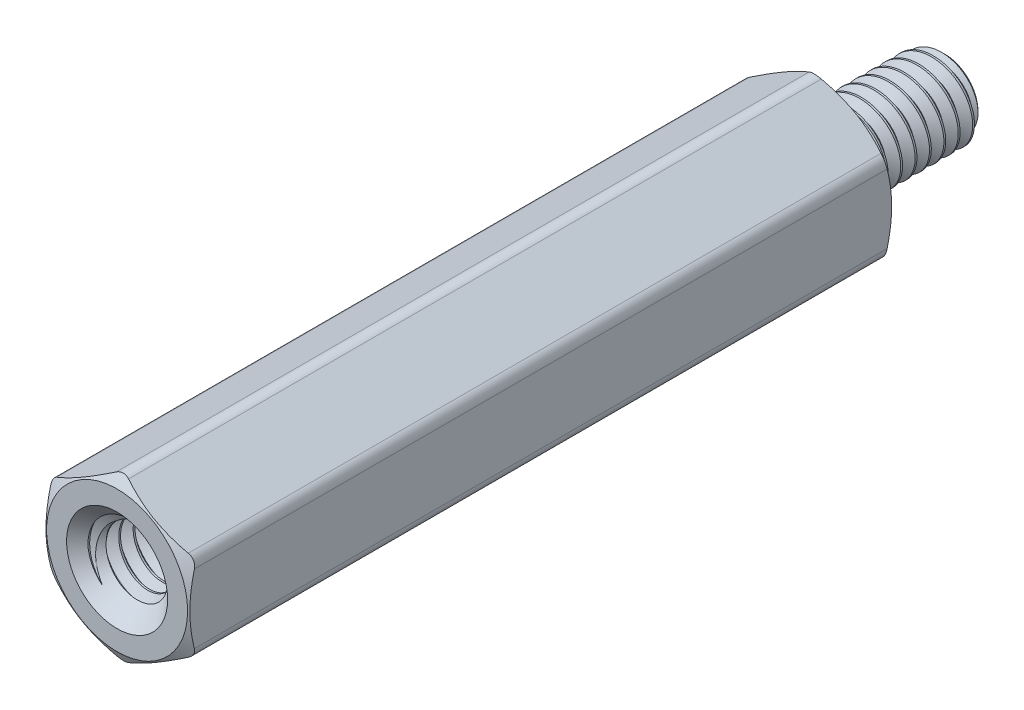
from build123d import *

# Parameters (mm, degrees)
SKETCH4_R           = 1.75
BOSS_EXTRUDE1_DEPTH = 22
SKETCH5_OUTSIDE_W   = 105.83
SKETCH5_OUTSIDE_H   = 106.526
SKETCH5_OUTSIDE_R   = 2.205
CUT_EXTRUDE1_DEPTH  = 27.127045374
CUT_EXTRUDE1_DRAFT  = -60
SKETCH6_OUTSIDE_W   = 92.458
SKETCH6_OUTSIDE_H   = 93.154
SKETCH6_OUTSIDE_R   = 2.205
CUT_EXTRUDE2_DEPTH  = 23.266847554
CUT_EXTRUDE2_DRAFT  = -60
FILLET1_R           = 0.3825
CUT_SWEEP1_PITCH    = 0.45
SKETCH9_R           = 1.475
BOSS_EXTRUDE2_DEPTH = 4.8
SKETCH10_W          = 4.8
SKETCH10_H          = 1.25
CUT_SWEEP2_PITCH    = 0.45


with BuildPart() as part:
    # Sketch3 → Revolve1 (revolve)
    with BuildSketch(Plane(origin=(0, 0, 0), x_dir=(0, 0, -1), z_dir=(1, 0, 0))):
        with BuildLine():
            Line((-17.2, 1.025), (-17.2, 0))
            Line((-17.2, 0), (3.9, 0))
            Line((3.9, 0), (3.9, 1.025))
            Line((3.9, 1.025), (3.675, 1.25))
            Line((3.675, 1.25), (0.63675, 1.25))
            Line((0.63675, 1.25), (0.468, 0.957716426))
            Line((0.468, 0.957716426), (0.225, 0.957716426))
            ThreePointArc((0.225, 0.957716426), (0.065900974, 1.0236174), (0, 1.182716426))
            Line((0, 1.182716426), (0, 2.25))
            Line((0, 2.25), (-22, 2.25))
            Line((-22, 2.25), (-22, 1.475))
            Line((-22, 1.475), (-21.775, 1.25))
            Line((-21.775, 1.25), (-17.425, 1.25))
            Line((-17.425, 1.25), (-17.2, 1.025))
        make_face()
    revolve(axis=Axis((0, 0, -3.9), (0, 0, 1)))

    # Sketch4 → Boss-Extrude1 (add)
    with BuildSketch(Plane.XY.offset(22)):
        Polygon((-2.25, 1.299038106), (-2.25, -1.299038106), (0, -2.598076211), (2.25, -1.299038106), (2.25, 1.299038106), (0, 2.598076211), align=None)
        Circle(SKETCH4_R, mode=Mode.SUBTRACT)
    extrude(amount=-BOSS_EXTRUDE1_DEPTH)


with BuildPart() as cut_extrude1_tool:
    # Sketch5 outside → Cut-Extrude1 (with draft: the straight prism first)
    with BuildSketch(Plane.XY.offset(22)):
        Rectangle(SKETCH5_OUTSIDE_W, SKETCH5_OUTSIDE_H)
        Circle(SKETCH5_OUTSIDE_R, mode=Mode.SUBTRACT)
    extrude(amount=-CUT_EXTRUDE1_DEPTH)
    # Cut-Extrude1: the draft: its side faces are tilted about the plane it starts from
    cut_extrude1_sides = [cut_extrude1_tool.faces().sort_by_distance(p)[0] for p in [
        (0, -53.263, 8.436477313),
        (52.915, 0, 8.436477313),
        (0, 53.263, 8.436477313),
        (-52.915, 0, 8.436477313),
        (-2.205, 0, 8.436477313),
    ]]
    draft(cut_extrude1_sides, Plane.XY.offset(22), CUT_EXTRUDE1_DRAFT)


with BuildPart() as part_1:
    add(part.part)

    # Cut-Extrude1: cut by cut_extrude1_tool
    add(cut_extrude1_tool.part, mode=Mode.SUBTRACT)


with BuildPart() as cut_extrude2_tool:
    # Sketch6 outside → Cut-Extrude2 (with draft: the straight prism first)
    with BuildSketch(Plane(origin=(0, 0, 0), x_dir=(-1, 0, 0), z_dir=(0, 0, -1))):
        Rectangle(SKETCH6_OUTSIDE_W, SKETCH6_OUTSIDE_H)
        Circle(SKETCH6_OUTSIDE_R, mode=Mode.SUBTRACT)
    extrude(amount=-CUT_EXTRUDE2_DEPTH)
    # Cut-Extrude2: the draft: its side faces are tilted about the plane it starts from
    cut_extrude2_sides = [cut_extrude2_tool.faces().sort_by_distance(p)[0] for p in [
        (0, -46.577, 11.633423777),
        (-46.229, 0, 11.633423777),
        (0, 46.577, 11.633423777),
        (46.229, 0, 11.633423777),
        (2.205, 0, 11.633423777),
    ]]
    draft(cut_extrude2_sides, Plane(origin=(0, 0, 0), x_dir=(-1, 0, 0), z_dir=(0, 0, -1)), CUT_EXTRUDE2_DRAFT)


with BuildPart() as part_2:
    add(part_1.part)

    # Cut-Extrude2: cut by cut_extrude2_tool
    add(cut_extrude2_tool.part, mode=Mode.SUBTRACT)

    # Fillet1
    fillet1_edges = [part_2.edges().sort_by_distance(p)[0] for p in [
        (0, 2.598076211, 11),
        (-2.25, -1.299038106, 11),
        (0, -2.598076211, 11),
        (2.25, -1.299038106, 11),
        (2.25, 1.299038106, 11),
        (-2.25, 1.299038106, 11),
    ]]
    fillet(fillet1_edges, radius=FILLET1_R)

    # Cut-Sweep1: the profile of Sketch7 profile screwed along a right-hand helix of 8.406667 turns, 6 arcs to a turn; built about Z, then put on its axis
    cut_sweep1_z = Axis((0, 0, 0), (0, 0, 1))
    cut_sweep1_corners = [(0.957416426, 0, -0.168923205), (0.957416426, 0, -0.224826795), (1.274356964, 0, -0.4078125), (1.274356964, 0, 0.0140625)]
    with BuildLine(mode=Mode.PRIVATE) as cut_sweep1_profile:
        Line(cut_sweep1_corners[0], cut_sweep1_corners[1])
        Line(cut_sweep1_corners[1], cut_sweep1_corners[2])
        Line(cut_sweep1_corners[2], cut_sweep1_corners[3])
        Line(cut_sweep1_corners[3], cut_sweep1_corners[0])
    cut_sweep1_cap = Face(cut_sweep1_profile.wire())
    cut_sweep1_turn_angles = [0, 30, 60, 90, 120, 150, 180, 210, 240, 270, 300, 330, 360]
    cut_sweep1_turn_weights = [1, 0.8660254037844387, 1, 0.8660254037844387, 1, 0.8660254037844387, 1, 0.8660254037844387, 1, 0.8660254037844387, 1, 0.8660254037844387, 1]
    cut_sweep1_turn_rails = [Edge.make_bspline([Vector(p[0], p[1], 0).rotate(cut_sweep1_z, cut_sweep1_turn_angles[k]) / cut_sweep1_turn_weights[k] + Vector(0, 0, p[2] + CUT_SWEEP1_PITCH * cut_sweep1_turn_angles[k] / 360) for k in range(13)], [0, 0, 0, 1, 1, 2, 2, 3, 3, 4, 4, 5, 5, 6, 6, 6], 2, cut_sweep1_turn_weights) for p in cut_sweep1_corners]
    cut_sweep1_turn_sides = [Face.make_surface_from_curves(cut_sweep1_turn_rails[p[0]], cut_sweep1_turn_rails[p[1]]) for p in [(0, 1), (1, 2), (2, 3), (3, 0)]]
    cut_sweep1_last_angles = [2880, 2910, 2940, 2970, 3000, 3013.2, 3026.4]
    cut_sweep1_last_weights = [1, 0.8660254037844387, 1, 0.8660254037844387, 1, 0.9735789028731574, 1]
    cut_sweep1_last_rails = [Edge.make_bspline([Vector(p[0], p[1], 0).rotate(cut_sweep1_z, cut_sweep1_last_angles[k]) / cut_sweep1_last_weights[k] + Vector(0, 0, p[2] + CUT_SWEEP1_PITCH * cut_sweep1_last_angles[k] / 360) for k in range(7)], [0, 0, 0, 1, 1, 2, 2, 3, 3, 3], 2, cut_sweep1_last_weights) for p in cut_sweep1_corners]
    cut_sweep1_last_sides = [Face.make_surface_from_curves(cut_sweep1_last_rails[p[0]], cut_sweep1_last_rails[p[1]]) for p in [(0, 1), (1, 2), (2, 3), (3, 0)]]
    cut_sweep1 = Plane(origin=(0, 0, -3.9), x_dir=(0, 1, 0), z_dir=(0, 0, 1)) * Solid(Shell([*[p.moved(Location((0, 0, CUT_SWEEP1_PITCH * i))) for i in range(8) for p in cut_sweep1_turn_sides], *cut_sweep1_last_sides, cut_sweep1_cap, cut_sweep1_cap.rotate(cut_sweep1_z, 3026.4).moved(Location((0, 0, CUT_SWEEP1_PITCH * 3026.4 / 360)))]))
    add(cut_sweep1, mode=Mode.SUBTRACT)

    # Sketch9 → Boss-Extrude2 (add)
    with BuildSketch(Plane.XY.offset(17.2)):
        Circle(SKETCH9_R)
    extrude(amount=BOSS_EXTRUDE2_DEPTH)


with BuildPart() as body_2:
    # Sketch10 → Revolve2 (revolve)
    with BuildSketch(Plane(origin=(0, 0, 0), x_dir=(0, 0, -1), z_dir=(1, 0, 0))):
        with Locations((-19.6, 0.625)):
            Rectangle(SKETCH10_W, SKETCH10_H)
    revolve(axis=Axis((0, 0, -3.9), (0, 0, 1)))

    # Cut-Sweep2: the profile of Sketch12 profile screwed along a right-hand helix of 11.666667 turns, 6 arcs to a turn; built about Z, then put on its axis
    cut_sweep2_z = Axis((0, 0, 0), (0, 0, 1))
    cut_sweep2_corners = [(0.957416426, 0, -0.224826795), (0.957416426, 0, -0.168923205), (1.274356964, 0, 0.0140625), (1.274356964, 0, -0.4078125)]
    with BuildLine(mode=Mode.PRIVATE) as cut_sweep2_profile:
        Line(cut_sweep2_corners[0], cut_sweep2_corners[1])
        Line(cut_sweep2_corners[1], cut_sweep2_corners[2])
        Line(cut_sweep2_corners[2], cut_sweep2_corners[3])
        Line(cut_sweep2_corners[3], cut_sweep2_corners[0])
    cut_sweep2_cap = Face(cut_sweep2_profile.wire())
    cut_sweep2_turn_angles = [0, 30, 60, 90, 120, 150, 180, 210, 240, 270, 300, 330, 360]
    cut_sweep2_turn_weights = [1, 0.8660254037844387, 1, 0.8660254037844387, 1, 0.8660254037844387, 1, 0.8660254037844387, 1, 0.8660254037844387, 1, 0.8660254037844387, 1]
    cut_sweep2_turn_rails = [Edge.make_bspline([Vector(p[0], p[1], 0).rotate(cut_sweep2_z, cut_sweep2_turn_angles[k]) / cut_sweep2_turn_weights[k] + Vector(0, 0, p[2] + CUT_SWEEP2_PITCH * cut_sweep2_turn_angles[k] / 360) for k in range(13)], [0, 0, 0, 1, 1, 2, 2, 3, 3, 4, 4, 5, 5, 6, 6, 6], 2, cut_sweep2_turn_weights) for p in cut_sweep2_corners]
    cut_sweep2_turn_sides = [Face.make_surface_from_curves(cut_sweep2_turn_rails[p[0]], cut_sweep2_turn_rails[p[1]]) for p in [(0, 1), (1, 2), (2, 3), (3, 0)]]
    cut_sweep2_last_angles = [3960, 3990, 4020, 4050, 4080, 4110, 4140, 4170, 4200]
    cut_sweep2_last_weights = [1, 0.8660254037844387, 1, 0.8660254037844387, 1, 0.8660254037844387, 1, 0.8660254037842601, 1]
    cut_sweep2_last_rails = [Edge.make_bspline([Vector(p[0], p[1], 0).rotate(cut_sweep2_z, cut_sweep2_last_angles[k]) / cut_sweep2_last_weights[k] + Vector(0, 0, p[2] + CUT_SWEEP2_PITCH * cut_sweep2_last_angles[k] / 360) for k in range(9)], [0, 0, 0, 1, 1, 2, 2, 3, 3, 4, 4, 4], 2, cut_sweep2_last_weights) for p in cut_sweep2_corners]
    cut_sweep2_last_sides = [Face.make_surface_from_curves(cut_sweep2_last_rails[p[0]], cut_sweep2_last_rails[p[1]]) for p in [(0, 1), (1, 2), (2, 3), (3, 0)]]
    cut_sweep2 = Plane(origin=(0, 0, 22), x_dir=(0, 1, 0), z_dir=(0, 0, -1)) * Solid(Shell([*[p.moved(Location((0, 0, CUT_SWEEP2_PITCH * i))) for i in range(11) for p in cut_sweep2_turn_sides], *cut_sweep2_last_sides, cut_sweep2_cap, cut_sweep2_cap.rotate(cut_sweep2_z, 4200).moved(Location((0, 0, CUT_SWEEP2_PITCH * 4200 / 360)))]))
    add(cut_sweep2, mode=Mode.SUBTRACT)


with BuildPart() as part_3:
    add(part_2.part)

    # Combine1: cut body 2
    add(body_2.part, mode=Mode.SUBTRACT)

    # Cut-Extrude3 cone 1 section (through the dimple's axis) → Cut-Extrude3 (revolve, cut)
    with BuildSketch(Plane(origin=(0, 0, 22), x_dir=(0, -1, 0), z_dir=(1, 0, 0))):
        Polygon((0, 0), (1.58, 0), (0, 1.58), align=None)
    revolve(axis=Axis((0, 0, 22), (0, 0, -1)), mode=Mode.SUBTRACT)


solid = part_3.part
